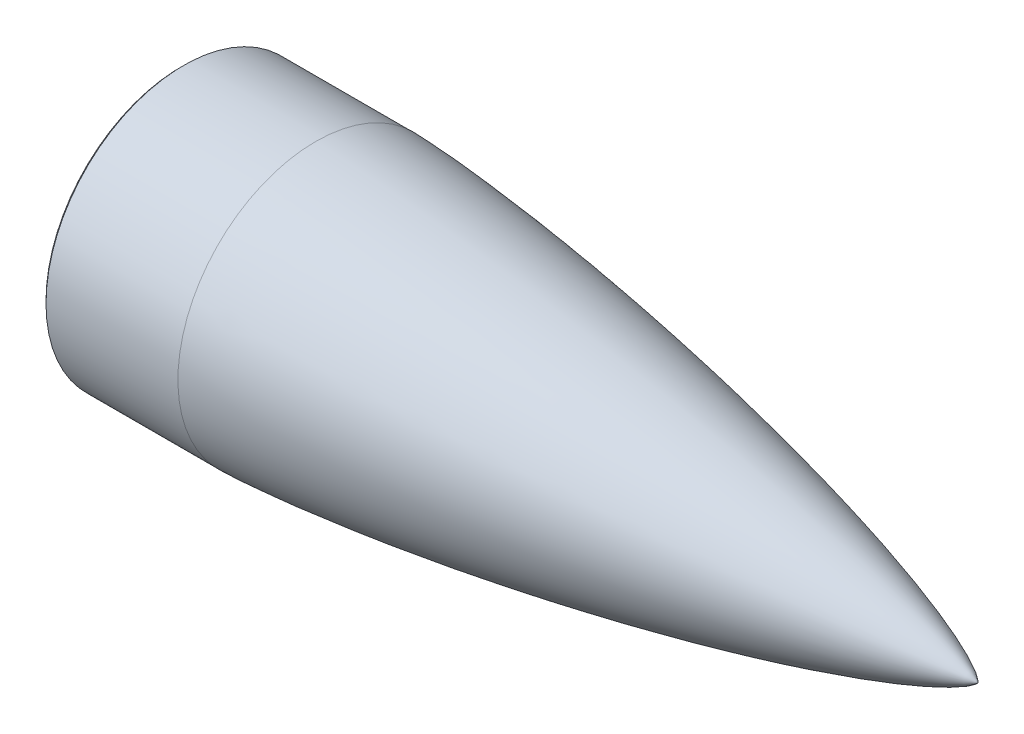
from build123d import *

# Parameters (mm, degrees)
CHAMFER1_SIZE = 1.5


with BuildPart() as part:
    # Sketch10 → Revolve1 (revolve)
    with BuildSketch(Plane.XY):
        with BuildLine():
            Line((11.512442623, 81.99983), (-82.704597473, 81.99983))
            Line((-82.704597473, 81.99983), (-82.704597473, 84.99983))
            Line((-82.704597473, 84.99983), (0.395312527, 84.99983))
            Line((0.395312527, 84.99983), (0.395312527, 85.09991))
            add(Edge.make_bspline(
                [(409.367200703, 0), (409.364799675, 0.013490725), (409.357804213, 0.039872835), (409.336049089, 0.090341886), (409.291362775, 0.173706525), (409.224951232, 0.274898618), (409.119715216, 0.414687961), (408.958242778, 0.603180986), (408.701520312, 0.869339558), (408.263700467, 1.27018438), (407.512162106, 1.876540447), (406.190622138, 2.81116796), (403.842489225, 4.261520805), (399.694988613, 6.48693355), (392.835915933, 9.68217433), (380.994342577, 14.496292312), (363.94136076, 20.500809416), (342.488204325, 27.165963004), (317.669060214, 34.071795467), (292.089500342, 40.560173563), (266.392438576, 46.564971163), (240.601230924, 52.149601479), (214.730147866, 57.351415034), (188.789398202, 62.193042352), (166.036165713, 66.123029219), (146.497122828, 69.272767781), (130.191352791, 71.748155523), (117.133130845, 73.636693756), (104.061526633, 75.430341157), (92.612311098, 76.913094213), (82.790477629, 78.118568772), (74.60013467, 79.077127586), (68.044553448, 79.815250522), (61.485654398, 80.523345092), (54.923413865, 81.199853463), (48.357816027, 81.842907754), (41.788819977, 82.450229283), (36.037928396, 82.947875457), (31.106395421, 83.348036436), (26.995286719, 83.662366935), (23.705487832, 83.901627804), (20.090435324, 84.150057716), (16.723466023, 84.364981323), (13.604804132, 84.548436532), (10.73466183, 84.702707178), (8.4380407, 84.816161605), (6.14090052, 84.918940251), (4.130411868, 84.996752324), (2.406773469, 85.054047451), (1.257436034, 85.083109333), (0.682717652, 85.096330397), (0.395312527, 85.09991)],
                knots=[0, 0, 0, 0, 0, 0.000130123, 0.000260245, 0.000520491, 0.000900391, 0.00128029, 0.001925099, 0.002881508, 0.004418208, 0.006927086, 0.011110697, 0.018279138, 0.03067276, 0.051704469, 0.08310228, 0.139908797, 0.202702513, 0.265496165, 0.328289682, 0.391083359, 0.453876973, 0.516670577, 0.579464197, 0.642257765, 0.673654596, 0.705051427, 0.736448267, 0.767845106, 0.799241874, 0.814940257, 0.830638641, 0.846337073, 0.862035505, 0.877733936, 0.893432368, 0.90913072, 0.924829072, 0.932678248, 0.940527424, 0.9483766, 0.956225776, 0.967169332, 0.97264111, 0.978112888, 0.983584666, 0.989056444, 0.994528222, 0.997264111, 1, 1, 1, 1, 1], degree=4))
            Line((409.367200703, 0), (369.367200703, 0))
            add(Edge.make_bspline(
                [(369.367200703, 0), (369.365248422, 0.012338489), (369.359365762, 0.036518378), (369.340585026, 0.082964007), (369.302253431, 0.158736421), (369.245486977, 0.250270687), (369.155639004, 0.376555746), (369.016602142, 0.54835284), (368.792837617, 0.793577299), (368.408608001, 1.164904965), (367.744687143, 1.729853685), (366.576009676, 2.601559154), (364.492772769, 3.960032328), (360.825927636, 6.040734396), (354.802145529, 9.01831007), (344.442943781, 13.507695011), (329.551954277, 19.128483965), (310.825116782, 25.398569259), (289.141215286, 31.933693508), (266.778481725, 38.106125474), (244.301328003, 43.846895186), (221.731942881, 49.212017941), (199.083916509, 54.234500927), (176.366846461, 58.934255644), (156.434516753, 62.771715365), (139.313258287, 65.864527435), (125.022095522, 68.307661522), (113.575382563, 70.17967865), (102.115021891, 71.96636138), (92.075349042, 73.451702031), (83.461426435, 74.665911128), (76.277456923, 75.636304155), (70.526832357, 76.386726745), (64.772730497, 77.110069349), (59.01510737, 77.804909351), (53.253924775, 78.469544472), (47.489112465, 79.101886687), (42.441647401, 79.62465649), (38.112854608, 80.048834251), (34.503878899, 80.384978489), (31.61568579, 80.642790078), (28.464731484, 80.911008917), (25.050632758, 81.18433613), (21.865391379, 81.419549228), (18.909246945, 81.617697726), (16.444784779, 81.767029289), (14.719071058, 81.861163774), (13.239440121, 81.933559207), (12.252683509, 81.973930117), (11.759243333, 81.99295272), (11.512442623, 81.99983)],
                knots=[0, 0, 0, 0, 0, 0.000134949, 0.000269899, 0.000539798, 0.000919537, 0.001299277, 0.001947431, 0.00293136, 0.004511869, 0.007081312, 0.011380263, 0.018707867, 0.031423867, 0.052705479, 0.084103008, 0.140910136, 0.203703492, 0.266497064, 0.329290816, 0.392084375, 0.454877964, 0.517671564, 0.580465191, 0.643258828, 0.674655593, 0.706052358, 0.737449114, 0.768845869, 0.800242661, 0.815941057, 0.831639453, 0.847337924, 0.863036395, 0.878734865, 0.894433336, 0.910131716, 0.925830096, 0.933679285, 0.941528475, 0.949377665, 0.957226855, 0.967920141, 0.978613427, 0.983960071, 0.989306714, 0.994653357, 0.997326678, 1, 1, 1, 1, 1], degree=4))
        make_face()
    revolve(axis=Axis((433.645840287, 0, 0), (-1, 0, 0)))

    # Chamfer1
    chamfer1_edges = [part.edges().sort_by_distance(p)[0] for p in [
        (-82.704597473, -84.99983, 0),
    ]]
    chamfer(chamfer1_edges, length=CHAMFER1_SIZE)


solid = part.part
